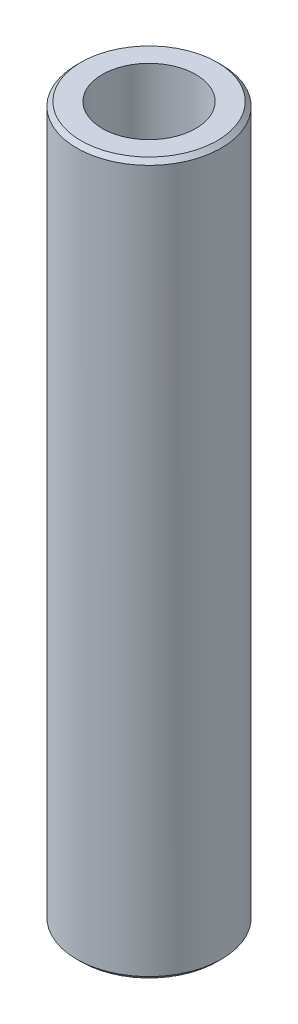
from build123d import *

# Parameters (mm, degrees)
SKETCH1_R           = 40
BOSS_EXTRUDE1_DEPTH = 393.492594541
SKETCH2_R           = 25.893605329
CUT_EXTRUDE1_DEPTH  = 398.537950337
CHAMFER1_SIZE       = 2.347049609


with BuildPart() as part:
    # Sketch1 → Boss-Extrude1 (new body)
    with BuildSketch(Plane(origin=(0, 0, 0), x_dir=(1, 0, 0), z_dir=(0, 1, 0))):
        Circle(SKETCH1_R)
    extrude(amount=BOSS_EXTRUDE1_DEPTH)

    # Sketch2 → Cut-Extrude1 (cut, through all)
    with BuildSketch(Plane(origin=(0, 0, 0), x_dir=(1, 0, 0), z_dir=(0, 1, 0))):
        Circle(SKETCH2_R)
    extrude(amount=CUT_EXTRUDE1_DEPTH, mode=Mode.SUBTRACT)

    # Chamfer1
    chamfer1_edges = [part.edges().sort_by_distance(p)[0] for p in [
        (-40, 393.492594541, 0),
        (-40, 0, 0),
    ]]
    chamfer(chamfer1_edges, length=CHAMFER1_SIZE)


solid = part.part
